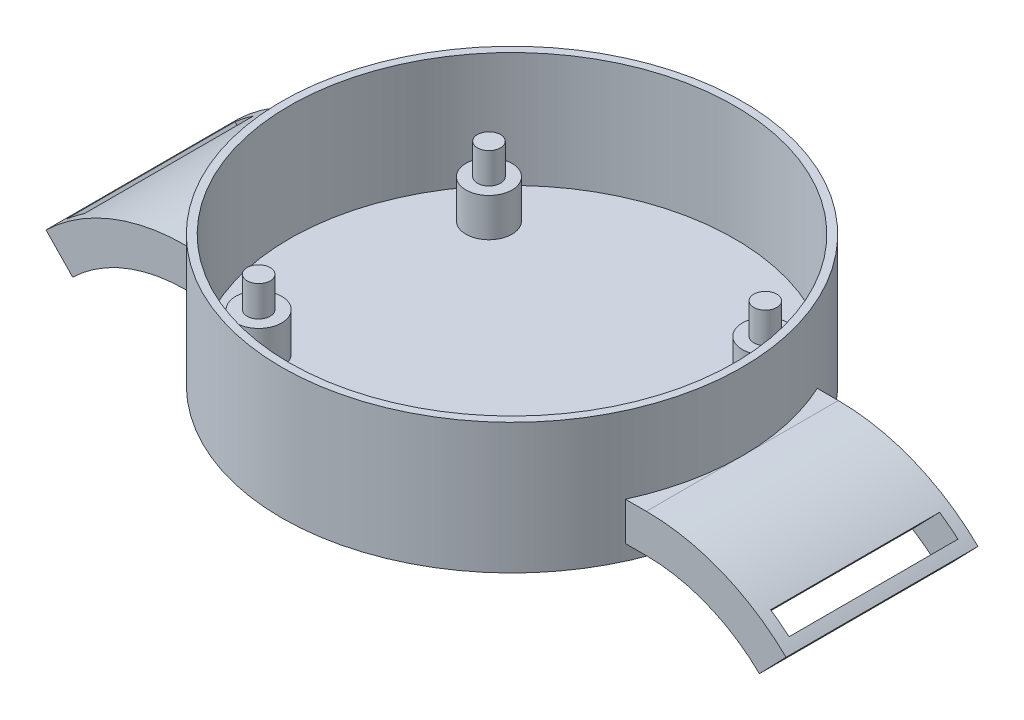
from build123d import *

# Parameters (mm, degrees)
SKETCH1_R                = 30
BOSS_EXTRUDE1_DEPTH      = 17
SKETCH2_R                = 29
CUT_EXTRUDE1_DEPTH       = 15
SKETCH3_R                = 3
BOSS_EXTRUDE5_DEPTH      = 5
SKETCH4_R                = 1.5
BOSS_EXTRUDE6_DEPTH      = 4
BOSS_EXTRUDE7_REACH      = 71.203
BOSS_EXTRUDE7_END_RADIUS = 30
SKETCH6_W                = 25
SKETCH6_H                = 5
SKETCH9_W                = 25
SKETCH9_H                = 5
SKETCH10_W               = 3
SKETCH10_H               = 22
CUT_EXTRUDE2_DEPTH       = 10
CIRPATTERN1_COUNT        = 2


with BuildPart() as part:
    # Sketch1 → Boss-Extrude1 (new body)
    with BuildSketch(Plane(origin=(0, 0, 0), x_dir=(1, 0, 0), z_dir=(0, 1, 0))):
        Circle(SKETCH1_R)
    extrude(amount=BOSS_EXTRUDE1_DEPTH)

    # Sketch2 → Cut-Extrude1 (cut)
    with BuildSketch(Plane(origin=(0, 17, 0), x_dir=(1, 0, 0), z_dir=(0, 1, 0))):
        Circle(SKETCH2_R)
    extrude(amount=-CUT_EXTRUDE1_DEPTH, mode=Mode.SUBTRACT)

    # Sketch3 → Boss-Extrude5 (add)
    with BuildSketch(Plane(origin=(0, 2, 0), x_dir=(1, 0, 0), z_dir=(0, 1, 0))):
        with Locations((-18, 15)):
            Circle(SKETCH3_R)
        with Locations((-18, -15)):
            Circle(SKETCH3_R)
        with Locations((18, -15)):
            Circle(SKETCH3_R)
        with Locations((18, 15)):
            Circle(SKETCH3_R)
    extrude(amount=BOSS_EXTRUDE5_DEPTH)

    # Sketch4 → Boss-Extrude6 (add)
    with BuildSketch(Plane(origin=(0, 7, 0), x_dir=(1, 0, 0), z_dir=(0, 1, 0))):
        with Locations((-18, 15)):
            Circle(SKETCH4_R)
        with Locations((-18, -15)):
            Circle(SKETCH4_R)
        with Locations((18, 15)):
            Circle(SKETCH4_R)
        with Locations((18, -15)):
            Circle(SKETCH4_R)
    extrude(amount=BOSS_EXTRUDE6_DEPTH)

    # Boss-Extrude7: up to this cylinder (the profile starts outside it)
    boss_extrude7_end = Plane(origin=(0, 4.5, 0), z_dir=(0, -1, 0)) * Cylinder(BOSS_EXTRUDE7_END_RADIUS, 203.406, mode=Mode.PRIVATE)
    # Sketch6 → Boss-Extrude7 (add, up to the surface)
    with BuildSketch(Plane.ZY.offset(30), mode=Mode.PRIVATE) as boss_extrude7_sk1:
        with Locations((0, 4.5)):
            Rectangle(SKETCH6_W, SKETCH6_H)
    boss_extrude7_tool1 = extrude(boss_extrude7_sk1.sketch, amount=-BOSS_EXTRUDE7_REACH, mode=Mode.PRIVATE) - boss_extrude7_end
    boss_extrude7 = boss_extrude7_tool1.solids().sort_by_distance((-30, 4.5, 0))[0] + boss_extrude7_tool1.solids().sort_by_distance((-30, 4.5, 0))[1]
    add(boss_extrude7)

    # Sweep1: sweep along a path in Sketch7
    with BuildLine(Plane.XY) as sweep1_path:
        ThreePointArc((-30, 4.5), (-38.878296183, 2.772912041), (-46.461716328, -2.156460621))
    # Sketch9 → Sweep1 (sweep)
    with BuildSketch(Plane.ZY.offset(30)):
        with Locations((0, 4.5)):
            Rectangle(SKETCH9_W, SKETCH9_H)
    sweep1 = sweep(path=sweep1_path.line)

    # Sketch10 → Cut-Extrude2 (cut)
    with BuildSketch(Plane(origin=(-23.106823791, 23.900351253, 0), x_dir=(0.7189410106609229, 0.6950710921839945, 0), z_dir=(-0.6950710921839945, 0.7189410106609229, 0))):
        with Locations((-31.902126733, 0)):
            Rectangle(SKETCH10_W, SKETCH10_H)
    cut_extrude2 = extrude(amount=-CUT_EXTRUDE2_DEPTH, mode=Mode.SUBTRACT)

    # CirPattern1: Boss-Extrude7, Sweep1, Cut-Extrude2 ×2 about axis
    cirpattern1_axis = Axis((0, 17, 0), (0, 1, 0))
    add([boss_extrude7.rotate(cirpattern1_axis, i * 360 / CIRPATTERN1_COUNT) for i in range(1, CIRPATTERN1_COUNT)])
    add([sweep1.rotate(cirpattern1_axis, i * 360 / CIRPATTERN1_COUNT) for i in range(1, CIRPATTERN1_COUNT)])
    add([cut_extrude2.rotate(cirpattern1_axis, i * 360 / CIRPATTERN1_COUNT) for i in range(1, CIRPATTERN1_COUNT)], mode=Mode.SUBTRACT)


solid = part.part
